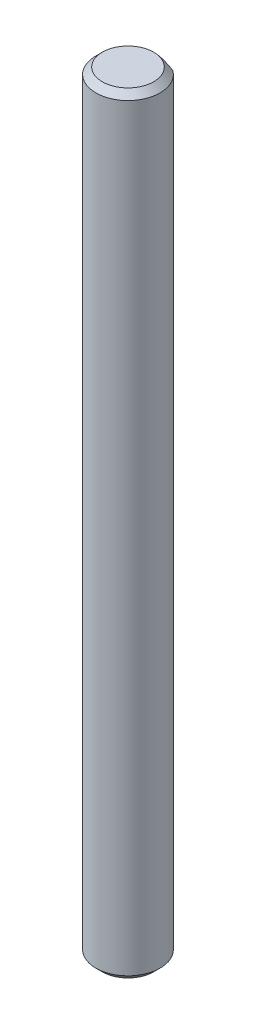
from build123d import *

# Parameters (mm, degrees)
SKETCH_1_R          = 2.5
EXTRUDE_1_DEPTH     = 60
CUT_EXTRUDE_START   = -15
CUT_EXTRUDE_1_DEPTH = 15
CHAMFER_1_SIZE      = 0.5


with BuildPart() as part:
    # Эскиз1 → Бобышка-Вытянуть1 (new body)
    with BuildSketch(Plane(origin=(0, 0, 0), x_dir=(1, 0, 0), z_dir=(0, 1, 0))):
        with Locations(Location((0, 0, 0), (0, 0, 270))):
            Circle(SKETCH_1_R)
    extrude(amount=EXTRUDE_1_DEPTH)

    # Эскиз2 → Вырез-Вытянуть1 (cut)
    with BuildSketch(Plane(origin=(0, 60, 0), x_dir=(1, 0, 0), z_dir=(0, 1, 0)).offset(CUT_EXTRUDE_START)):
        with BuildLine():
            Line((-1.5, 2), (1.5, 2))
            ThreePointArc((1.5, 2), (0, 2.5), (-1.5, 2))
        make_face()
    extrude(amount=CUT_EXTRUDE_1_DEPTH, mode=Mode.SUBTRACT)

    # Фаска1
    chamfer_1_edges = [part.edges().sort_by_distance(p)[0] for p in [
        (-2.371708245, 60, 0.790569415),
        (0, 0, -2.5),
    ]]
    chamfer(chamfer_1_edges, length=CHAMFER_1_SIZE - 0.0001)  # a hair under: the kernel refuses the full size


solid = part.part
